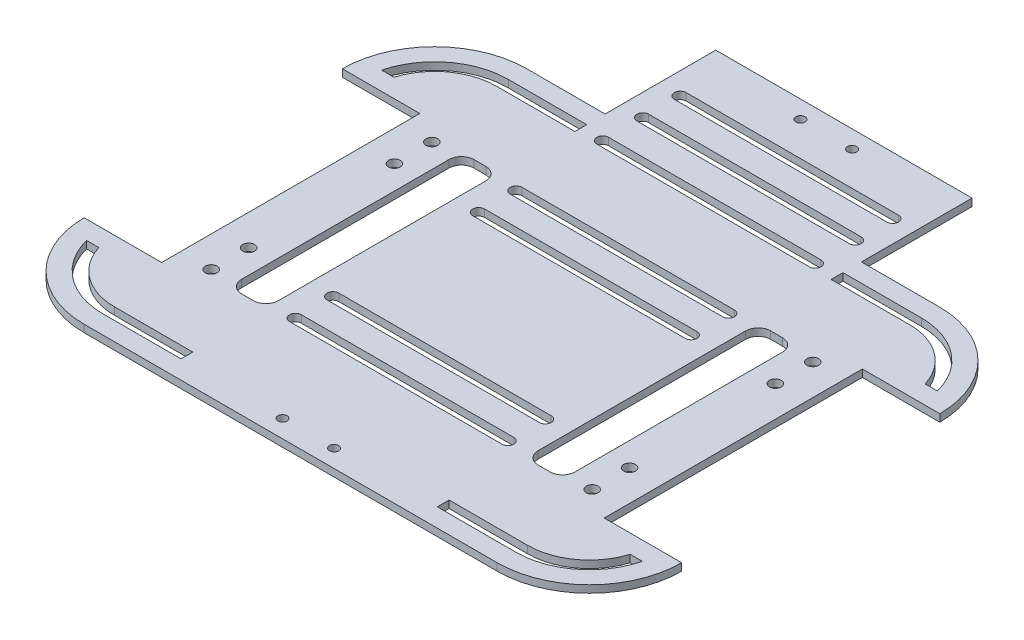
from build123d import *

# Parameters (mm, degrees)
SKETCH1_R            = 1.5875
BOSS_EXTRUDE5_DEPTH  = 1.5875
FILLET2_R            = 2.54
FILLET3_R            = 2.54
FILLET4_R            = 5.08
CUT_EXTRUDE1_START   = -2.54
SKETCH2_R            = 2.38125
SKETCH2_R_2          = 1.5875
CUT_EXTRUDE1_DEPTH   = 2.54
SKETCH3_R            = 1.5875
CUT_EXTRUDE2_DEPTH   = 2.54
CUT_EXTRUDE3_DEPTH   = 2.54
SKETCH5_W            = 15
SKETCH5_H            = 34.925
CUT_EXTRUDE4_DEPTH   = 109.650407999
FILLET5_R            = 7.62
FILLET6_R            = 7.62
SKETCH6_R            = 79.375
CUT_EXTRUDE5_DEPTH   = 0.5875
SKETCH8_W            = 24.650607139
SKETCH8_H            = 2
SKETCH8_W_2          = 29.436542116
CUT_EXTRUDE6_DEPTH   = 2.54
FILLET7_R            = 2.54
SKETCH11_W           = 22.261978792
SKETCH11_H           = 11.326269911
SKETCH11_H_2         = 10.545147849
BOSS_EXTRUDE7_DEPTH  = 1
SKETCH12_R           = 1.25
CUT_EXTRUDE7_DEPTH   = 2.54
SKETCH14_R           = 1.5875
BOSS_EXTRUDE8_DEPTH  = 1
SKETCH15_R           = 1.5875
CUT_EXTRUDE8_DEPTH   = 2.54
SKETCH16_W           = 0.79375
SKETCH16_H           = 25.283333333
SKETCH16_H_2         = 48.566666667
SKETCH16_H_3         = 73.85
BOSS_EXTRUDE13_DEPTH = 1
CUT_EXTRUDE10_DEPTH  = 109.643412285
BOSS_EXTRUDE16_START = -1
BOSS_EXTRUDE16_DEPTH = 1
SKETCH19_R           = 1.25
BOSS_EXTRUDE20_DEPTH = 2
SKETCH20_R           = 1.5875
CUT_EXTRUDE13_DEPTH  = 2
CUT_EXTRUDE18_DEPTH  = 2
SKETCH24_R           = 79.375
CUT_EXTRUDE20_DEPTH  = 297.956328007


with BuildPart() as part:
    # Sketch1 → Boss-Extrude5 (new body)
    with BuildSketch(Plane(origin=(0, 0, 0), x_dir=(1, 0, 0), z_dir=(0, 1, 0))):
        with BuildLine():
            ThreePointArc((-63.5, -47.625), (-35.497579143, -70.995158286), (0, -79.375))
            ThreePointArc((0, -79.375), (35.497579143, -70.995158286), (63.5, -47.625))
            Line((63.5, -47.625), (50.8, -47.625))
            Line((50.8, -47.625), (50.8, 22.225))
            Line((50.8, 22.225), (76.2, 22.225))
            ThreePointArc((76.2, 22.225), (0, 79.375), (-76.2, 22.225))
            Line((-76.2, 22.225), (-50.8, 22.225))
            Line((-50.8, 22.225), (-50.8, -47.625))
            Line((-50.8, -47.625), (-63.5, -47.625))
        make_face()
        with Locations(Location((-7.14375, -66.675, 0), (0, 0, 270))):
            Circle(SKETCH1_R, mode=Mode.SUBTRACT)
        with BuildLine():
            ThreePointArc((8.73125, -66.675), (7.14375, -68.2625), (5.55625, -66.675))
            ThreePointArc((5.55625, -66.675), (7.14375, -65.0875), (8.73125, -66.675))
        make_face(mode=Mode.SUBTRACT)
        with Locations(Location((-7.14375, 66.675, 0), (0, 0, 270))):
            Circle(SKETCH1_R, mode=Mode.SUBTRACT)
        with Locations(Location((7.14375, 66.675, 0), (0, 0, 270))):
            Circle(SKETCH1_R, mode=Mode.SUBTRACT)
    extrude(amount=BOSS_EXTRUDE5_DEPTH)

    # Fillet2
    fillet2_edges = [part.edges().sort_by_distance(p)[0] for p in [
        (-63.5, 0.79375, 47.625),
    ]]
    fillet(fillet2_edges, radius=FILLET2_R)

    # Fillet3
    fillet3_edges = [part.edges().sort_by_distance(p)[0] for p in [
        (63.5, 0.79375, 47.625),
    ]]
    fillet(fillet3_edges, radius=FILLET3_R)

    # Fillet4
    fillet4_edges = [part.edges().sort_by_distance(p)[0] for p in [
        (-76.2, 0.79375, -22.225),
        (76.2, 0.79375, -22.225),
    ]]
    fillet(fillet4_edges, radius=FILLET4_R)

    # Sketch2 → Cut-Extrude1 (cut)
    # profile 1 of 10: a face of its own
    with BuildSketch(Plane(origin=(0, 1.5875, 0), x_dir=(1, 0, 0), z_dir=(0, 1, 0)).offset(CUT_EXTRUDE1_START)):
        with BuildLine():
            Line((-61.088622125, 27.654457796), (-59.642408406, 26.999765402))
            ThreePointArc((-59.642408406, 26.999765402), (-52.384826382, 39.268743005), (-42.643785254, 49.676068599))
            Line((-42.643785254, 49.676068599), (-43.677815048, 50.880617741))
            Line((-43.677815048, 50.880617741), (-44.711844841, 52.085166883))
            ThreePointArc((-44.711844841, 52.085166883), (-54.925289002, 41.173126022), (-62.534835843, 28.309150189))
            Line((-62.534835843, 28.309150189), (-61.088622125, 27.654457796))
        make_face()
    # profile 2 of 10: a face of its own
    with BuildSketch(Plane(origin=(0, 1.5875, 0), x_dir=(1, 0, 0), z_dir=(0, 1, 0)).offset(CUT_EXTRUDE1_START)):
        with BuildLine():
            Line((-39.077069744, 54.493774041), (-38.151958122, 53.203686937))
            ThreePointArc((-38.151958122, 53.203686937), (-25.732218917, 60.200142208), (-12.092567045, 64.342629994))
            Line((-12.092567045, 64.342629994), (-12.385788543, 65.902815048))
            Line((-12.385788543, 65.902815048), (-12.679010041, 67.463000102))
            ThreePointArc((-12.679010041, 67.463000102), (-26.980132574, 63.119617589), (-40.002181367, 55.783861145))
            Line((-40.002181367, 55.783861145), (-39.077069744, 54.493774041))
        make_face()
    # profile 3 of 10: a face of its own
    with BuildSketch(Plane(origin=(0, 1.5875, 0), x_dir=(1, 0, 0), z_dir=(0, 1, 0)).offset(CUT_EXTRUDE1_START)):
        with Locations(Location((-7.14375, 66.675, 0), (0, 0, 270))):
            Circle(SKETCH2_R)
        with Locations((-7.14375, 66.675)):
            Circle(SKETCH2_R_2, mode=Mode.SUBTRACT)
    # profile 4 of 10: a face of its own
    with BuildSketch(Plane(origin=(0, 1.5875, 0), x_dir=(1, 0, 0), z_dir=(0, 1, 0)).offset(CUT_EXTRUDE1_START)):
        with Locations(Location((7.14375, 66.675, 0), (0, 0, 270))):
            Circle(SKETCH2_R)
        with Locations((7.14375, 66.675)):
            Circle(SKETCH2_R_2, mode=Mode.SUBTRACT)
    # profile 5 of 10: a face of its own
    with BuildSketch(Plane(origin=(0, 1.5875, 0), x_dir=(1, 0, 0), z_dir=(0, 1, 0)).offset(CUT_EXTRUDE1_START)):
        with BuildLine():
            ThreePointArc((12.679010041, 67.463000102), (26.980132574, 63.119617589), (40.002181367, 55.783861145))
            Line((40.002181367, 55.783861145), (39.077069744, 54.493774041))
            Line((39.077069744, 54.493774041), (38.151958122, 53.203686937))
            ThreePointArc((38.151958122, 53.203686937), (25.732218917, 60.200142208), (12.092567045, 64.342629994))
            Line((12.092567045, 64.342629994), (12.385788543, 65.902815048))
            Line((12.385788543, 65.902815048), (12.679010041, 67.463000102))
        make_face()
    # profile 6 of 10: a face of its own
    with BuildSketch(Plane(origin=(0, 1.5875, 0), x_dir=(1, 0, 0), z_dir=(0, 1, 0)).offset(CUT_EXTRUDE1_START)):
        with BuildLine():
            ThreePointArc((44.711844841, 52.085166883), (54.925289002, 41.173126022), (62.534835843, 28.309150189))
            Line((62.534835843, 28.309150189), (59.642408406, 26.999765402))
            ThreePointArc((59.642408406, 26.999765402), (52.384826382, 39.268743005), (42.643785254, 49.676068599))
            Line((42.643785254, 49.676068599), (43.677815048, 50.880617741))
            Line((43.677815048, 50.880617741), (44.711844841, 52.085166883))
        make_face()
    # profile 7 of 10: a face of its own
    with BuildSketch(Plane(origin=(0, 1.5875, 0), x_dir=(1, 0, 0), z_dir=(0, 1, 0)).offset(CUT_EXTRUDE1_START)):
        with BuildLine():
            ThreePointArc((-12.679010041, -67.463000102), (-26.980132574, -63.119617589), (-40.002181367, -55.783861145))
            Line((-40.002181367, -55.783861145), (-39.077069744, -54.493774041))
            Line((-39.077069744, -54.493774041), (-38.151958122, -53.203686937))
            ThreePointArc((-38.151958122, -53.203686937), (-25.732218917, -60.200142208), (-12.092567045, -64.342629994))
            Line((-12.092567045, -64.342629994), (-12.385788543, -65.902815048))
            Line((-12.385788543, -65.902815048), (-12.679010041, -67.463000102))
        make_face()
    # profile 8 of 10: a face of its own
    with BuildSketch(Plane(origin=(0, 1.5875, 0), x_dir=(1, 0, 0), z_dir=(0, 1, 0)).offset(CUT_EXTRUDE1_START)):
        with Locations(Location((-7.14375, -66.675, 0), (0, 0, 270))):
            Circle(SKETCH2_R)
        with Locations((-7.14375, -66.675)):
            Circle(SKETCH2_R_2, mode=Mode.SUBTRACT)
    # profile 9 of 10: a face of its own
    with BuildSketch(Plane(origin=(0, 1.5875, 0), x_dir=(1, 0, 0), z_dir=(0, 1, 0)).offset(CUT_EXTRUDE1_START)):
        with Locations(Location((7.14375, -66.675, 0), (0, 0, 270))):
            Circle(SKETCH2_R)
        with Locations((7.14375, -66.675)):
            Circle(SKETCH2_R_2, mode=Mode.SUBTRACT)
    # profile 10 of 10: a face of its own
    with BuildSketch(Plane(origin=(0, 1.5875, 0), x_dir=(1, 0, 0), z_dir=(0, 1, 0)).offset(CUT_EXTRUDE1_START)):
        with BuildLine():
            ThreePointArc((12.092567045, -64.342629994), (25.732218917, -60.200142208), (38.151958122, -53.203686937))
            Line((38.151958122, -53.203686937), (39.077069744, -54.493774041))
            Line((39.077069744, -54.493774041), (40.002181367, -55.783861145))
            ThreePointArc((40.002181367, -55.783861145), (26.980132574, -63.119617589), (12.679010041, -67.463000102))
            Line((12.679010041, -67.463000102), (12.385788543, -65.902815048))
            Line((12.385788543, -65.902815048), (12.092567045, -64.342629994))
        make_face()
    extrude(amount=CUT_EXTRUDE1_DEPTH, mode=Mode.SUBTRACT)

    # Sketch3 → Cut-Extrude2 (cut)
    with BuildSketch(Plane(origin=(0, 1.5875, 0), x_dir=(1, 0, 0), z_dir=(0, 1, 0))):
        with Locations(Location((-44.45, -47.625, 0), (0, 0, 270))):
            Circle(SKETCH3_R)
        with Locations(Location((-44.45, 22.225, 0), (0, 0, 270))):
            Circle(SKETCH3_R)
        with Locations(Location((44.45, 22.225, 0), (0, 0, 270))):
            Circle(SKETCH3_R)
        with Locations(Location((44.45, -47.625, 0), (0, 0, 270))):
            Circle(SKETCH3_R)
    extrude(amount=-CUT_EXTRUDE2_DEPTH, mode=Mode.SUBTRACT)

    # Sketch4 → Cut-Extrude3 (cut)
    with BuildSketch(Plane(origin=(0, 1.5875, 0), x_dir=(1, 0, 0), z_dir=(0, 1, 0))):
        with BuildLine():
            ThreePointArc((-44.45, -11.1125), (-46.0375, -12.7), (-44.45, -14.2875))
            Line((-44.45, -14.2875), (-44.45, -11.1125))
        make_face()
        with BuildLine():
            Line((-44.45, -11.1125), (-44.45, -14.2875))
            ThreePointArc((-44.45, -14.2875), (-43.327467985, -13.822532015), (-42.8625, -12.7))
            ThreePointArc((-42.8625, -12.7), (-43.327467985, -11.577467985), (-44.45, -11.1125))
        make_face()
        with BuildLine():
            ThreePointArc((44.45, -11.1125), (42.8625, -12.7), (44.45, -14.2875))
            Line((44.45, -14.2875), (44.45, -11.1125))
        make_face()
        with BuildLine():
            Line((44.45, -11.1125), (44.45, -14.2875))
            ThreePointArc((44.45, -14.2875), (45.572532015, -13.822532015), (46.0375, -12.7))
            ThreePointArc((46.0375, -12.7), (45.572532015, -11.577467985), (44.45, -11.1125))
        make_face()
    extrude(amount=-CUT_EXTRUDE3_DEPTH, mode=Mode.SUBTRACT)

    # Sketch5 → Cut-Extrude4 (cut, through all)
    with BuildSketch(Plane(origin=(0, 1.5875, 0), x_dir=(1, 0, 0), z_dir=(0, 1, 0))):
        with Locations((-27.3, 4.7625)):
            Rectangle(SKETCH5_W, SKETCH5_H)
        with Locations((27.3, 4.7625)):
            Rectangle(SKETCH5_W, SKETCH5_H)
    extrude(amount=-CUT_EXTRUDE4_DEPTH, mode=Mode.SUBTRACT)

    # Fillet5
    # the kernel refuses this fillet: 7.62 mm, written as the material it adds along each edge
    with BuildSketch(Plane(origin=(-19.8, 1.5875, 12.7), x_dir=(0, 0, -1), z_dir=(0, -1, 0))) as fillet5_piece_1:
        with BuildLine():
            CenterArc((FILLET5_R, -FILLET5_R), FILLET5_R, 90, 90)
            Line((0, -FILLET5_R), (0, 0))
            Line((0, 0), (FILLET5_R, 0))
        make_face()
    extrude(amount=1.5875)
    with BuildSketch(Plane(origin=(-34.8, 1.5875, 12.7), x_dir=(0, 0, -1), z_dir=(0, -1, 0)), Plane(origin=(-19.8, 1.5875, -22.225), x_dir=(0, 0, 1), z_dir=(0, -1, 0)), Plane(origin=(-34.8, 1.5875, -22.225), x_dir=(1, 0, 0), z_dir=(0, -1, 0))) as fillet5_piece_2:
        with BuildLine():
            CenterArc((FILLET5_R, FILLET5_R), FILLET5_R, 180, 90)
            Line((0, FILLET5_R), (0, 0))
            Line((0, 0), (FILLET5_R, 0))
        make_face()
    extrude(amount=1.5875)

    # Fillet6
    # the kernel refuses this fillet: 7.62 mm, written as the material it adds along each edge
    with BuildSketch(Plane(origin=(34.8, 1.5875, 12.7), x_dir=(0, 0, -1), z_dir=(0, -1, 0)), Plane(origin=(34.8, 1.5875, -22.225), x_dir=(-1, 0, 0), z_dir=(0, -1, 0))) as fillet6_piece_1:
        with BuildLine():
            CenterArc((FILLET6_R, -FILLET6_R), FILLET6_R, 90, 90)
            Line((0, -FILLET6_R), (0, 0))
            Line((0, 0), (FILLET6_R, 0))
        make_face()
    extrude(amount=1.5875)
    with BuildSketch(Plane(origin=(19.8, 1.5875, -22.225), x_dir=(1, 0, 0), z_dir=(0, -1, 0)), Plane(origin=(19.8, 1.5875, 12.7), x_dir=(0, 0, -1), z_dir=(0, -1, 0))) as fillet6_piece_2:
        with BuildLine():
            CenterArc((FILLET6_R, FILLET6_R), FILLET6_R, 180, 90)
            Line((0, FILLET6_R), (0, 0))
            Line((0, 0), (FILLET6_R, 0))
        make_face()
    extrude(amount=1.5875)

    # Sketch6 → Cut-Extrude5 (cut)
    with BuildSketch(Plane(origin=(0, 0, 0), x_dir=(-1, 0, 0), z_dir=(0, -1, 0))):
        Circle(SKETCH6_R)
    extrude(amount=-CUT_EXTRUDE5_DEPTH, mode=Mode.SUBTRACT)

    # Sketch8 → Cut-Extrude6 (cut)
    with BuildSketch(Plane(origin=(0, 1.5875, 0), x_dir=(1, 0, 0), z_dir=(0, 1, 0))):
        with Locations((-63.12530357, -48.625)):
            Rectangle(SKETCH8_W, SKETCH8_H)
        with Locations((63.12530357, -48.625)):
            Rectangle(SKETCH8_W, SKETCH8_H)
        with Locations((65.518271058, 23.225)):
            Rectangle(SKETCH8_W_2, SKETCH8_H)
        with Locations((-65.518271058, 23.225)):
            Rectangle(SKETCH8_W_2, SKETCH8_H)
    extrude(amount=-CUT_EXTRUDE6_DEPTH, mode=Mode.SUBTRACT)

    # Fillet7
    fillet7_edges = [part.edges().sort_by_distance(p)[0] for p in [
        (-73.13527216, 1.0875, -24.225),
    ]]
    fillet(fillet7_edges, radius=FILLET7_R)
    fillet7_2_edges = [part.edges().sort_by_distance(p)[0] for p in [
        (-60.680646055, 1.0875, 49.625),
    ]]
    fillet(fillet7_2_edges, radius=FILLET7_R)
    fillet7_3_edges = [part.edges().sort_by_distance(p)[0] for p in [
        (73.13527216, 1.0875, -24.225),
    ]]
    fillet(fillet7_3_edges, radius=FILLET7_R)
    fillet7_4_edges = [part.edges().sort_by_distance(p)[0] for p in [
        (60.680646055, 1.0875, 49.625),
    ]]
    fillet(fillet7_4_edges, radius=FILLET7_R)

    # Sketch11 → Boss-Extrude7 (add)
    with BuildSketch(Plane(origin=(0, 1.5875, 0), x_dir=(1, 0, 0), z_dir=(0, 1, 0))):
        with Locations((0.072710042, 66.44599468)):
            Rectangle(SKETCH11_W, SKETCH11_H)
        with Locations((0.072710042, -66.930597559)):
            Rectangle(SKETCH11_W, SKETCH11_H_2)
    extrude(amount=-BOSS_EXTRUDE7_DEPTH)

    # Sketch12 → Cut-Extrude7 (cut)
    with BuildSketch(Plane(origin=(0, 1.5875, 0), x_dir=(1, 0, 0), z_dir=(0, 1, 0))):
        with Locations(Location((-6.75, 65.902815048, 0), (0, 0, 270))):
            Circle(SKETCH12_R)
        with Locations(Location((6.75, 65.902815048, 0), (0, 0, 270))):
            Circle(SKETCH12_R)
        with Locations(Location((6.75, -65.902815048, 0), (0, 0, 270))):
            Circle(SKETCH12_R)
        with Locations(Location((-6.75, -65.902815048, 0), (0, 0, 270))):
            Circle(SKETCH12_R)
    extrude(amount=-CUT_EXTRUDE7_DEPTH, mode=Mode.SUBTRACT)

    # Sketch14 → Boss-Extrude8 (add)
    with BuildSketch(Plane(origin=(0, 1.5875, 0), x_dir=(1, 0, 0), z_dir=(0, 1, 0))):
        with Locations((-44.45, -12.7)):
            Circle(SKETCH14_R)
        with Locations((44.45, -12.7)):
            Circle(SKETCH14_R)
    extrude(amount=-BOSS_EXTRUDE8_DEPTH)

    # Sketch15 → Cut-Extrude8 (cut)
    with BuildSketch(Plane(origin=(0, 1.5875, 0), x_dir=(1, 0, 0), z_dir=(0, 1, 0))):
        with Locations(Location((-44.45, -1.058333333, 0), (0, 0, 270))):
            Circle(SKETCH15_R)
        with Locations(Location((-44.45, -24.341666667, 0), (0, 0, 270))):
            Circle(SKETCH15_R)
        with Locations(Location((44.45, -24.341666667, 0), (0, 0, 270))):
            Circle(SKETCH15_R)
        with Locations(Location((44.45, -1.058333333, 0), (0, 0, 270))):
            Circle(SKETCH15_R)
    extrude(amount=-CUT_EXTRUDE8_DEPTH, mode=Mode.SUBTRACT)

    # Sketch16 → Boss-Extrude13 (add)
    with BuildSketch(Plane(origin=(0, 1.5875, 0), x_dir=(1, 0, 0), z_dir=(0, 1, 0))):
        with Locations((-51.196875, 11.583333334)):
            Rectangle(SKETCH16_W, SKETCH16_H)
        with Locations((-51.196875, -25.341666667)):
            Rectangle(SKETCH16_W, SKETCH16_H_2)
        with Locations((51.196875, -12.7)):
            Rectangle(SKETCH16_W, SKETCH16_H_3)
    extrude(amount=-BOSS_EXTRUDE13_DEPTH)

    # Sketch17 → Cut-Extrude10 (cut, through all)
    with BuildSketch(Plane(origin=(0, 1.5875, 0), x_dir=(1, 0, 0), z_dir=(0, 1, 0))):
        with BuildLine():
            ThreePointArc((-59.642408406, 26.999765402), (-40.146347222, 51.715326712), (-11.368591443, 64.474485968))
            Line((-11.368591443, 64.474485968), (-11.919924408, 67.601250584))
            ThreePointArc((-11.919924408, 67.601250584), (-42.093290669, 54.223321173), (-62.534835843, 28.309150189))
            Line((-62.534835843, 28.309150189), (-59.642408406, 26.999765402))
        make_face()
        with BuildLine():
            Line((11.919924408, 67.601250584), (11.368591443, 64.474485968))
            ThreePointArc((11.368591443, 64.474485968), (40.146347222, 51.715326712), (59.642408406, 26.999765402))
            Line((59.642408406, 26.999765402), (62.534835843, 28.309150189))
            ThreePointArc((62.534835843, 28.309150189), (42.093290669, 54.223321173), (11.919924408, 67.601250584))
        make_face()
        with BuildLine():
            ThreePointArc((38.151958122, -53.203686937), (25.393482136, -60.343808939), (11.368591443, -64.474485968))
            Line((11.368591443, -64.474485968), (11.919924408, -67.601250584))
            ThreePointArc((11.919924408, -67.601250584), (26.624968362, -63.270251604), (40.002181367, -55.783861145))
            Line((40.002181367, -55.783861145), (38.151958122, -53.203686937))
        make_face()
        with BuildLine():
            ThreePointArc((-11.368591443, -64.474485968), (-25.393482136, -60.343808939), (-38.151958122, -53.203686937))
            Line((-38.151958122, -53.203686937), (-40.002181367, -55.783861145))
            ThreePointArc((-40.002181367, -55.783861145), (-26.624968362, -63.270251604), (-11.919924408, -67.601250584))
            Line((-11.919924408, -67.601250584), (-11.368591443, -64.474485968))
        make_face()
    extrude(amount=-CUT_EXTRUDE10_DEPTH, mode=Mode.SUBTRACT)

    # Sketch18 → Boss-Extrude16 (add)
    with BuildSketch(Plane(origin=(0, 1.5875, 0), x_dir=(1, 0, 0), z_dir=(0, 1, 0)).offset(BOSS_EXTRUDE16_START)):
        with BuildLine():
            Line((-34.32205442, -59.447542075), (-32.73455442, -56.697911418))
            ThreePointArc((-32.73455442, -56.697911418), (-35.486290539, -55.017518992), (-38.151958122, -53.203686937))
            Line((-38.151958122, -53.203686937), (-40.002181367, -55.783861145))
            ThreePointArc((-40.002181367, -55.783861145), (-37.207239159, -57.685657078), (-34.32205442, -59.447542075))
        make_face()
        with BuildLine():
            ThreePointArc((38.151958122, -53.203686937), (35.486290539, -55.017518992), (32.73455442, -56.697911418))
            Line((32.73455442, -56.697911418), (34.32205442, -59.447542075))
            ThreePointArc((34.32205442, -59.447542075), (37.207239159, -57.685657078), (40.002181367, -55.783861145))
            Line((40.002181367, -55.783861145), (38.151958122, -53.203686937))
        make_face()
        with BuildLine():
            Line((59.447542075, 34.32205442), (56.697911418, 32.73455442))
            ThreePointArc((56.697911418, 32.73455442), (58.240788589, 29.90342383), (59.642408406, 26.999765402))
            Line((59.642408406, 26.999765402), (62.534835843, 28.309150189))
            ThreePointArc((62.534835843, 28.309150189), (61.065242855, 31.353624885), (59.447542075, 34.32205442))
        make_face()
        with BuildLine():
            Line((34.32205442, 59.447542075), (32.73455442, 56.697911418))
            ThreePointArc((32.73455442, 56.697911418), (37.551538139, 53.629154344), (42.082731979, 50.152247023))
            Line((42.082731979, 50.152247023), (44.12358264, 52.584438129))
            ThreePointArc((44.12358264, 52.584438129), (39.372643325, 56.229962084), (34.32205442, 59.447542075))
        make_face()
        with BuildLine():
            ThreePointArc((-42.082731979, 50.152247023), (-37.551538139, 53.629154344), (-32.73455442, 56.697911418))
            Line((-32.73455442, 56.697911418), (-34.32205442, 59.447542075))
            ThreePointArc((-34.32205442, 59.447542075), (-39.372643325, 56.229962084), (-44.12358264, 52.584438129))
            Line((-44.12358264, 52.584438129), (-42.082731979, 50.152247023))
        make_face()
        with BuildLine():
            ThreePointArc((-59.642408406, 26.999765402), (-58.240788589, 29.90342383), (-56.697911418, 32.73455442))
            Line((-56.697911418, 32.73455442), (-59.447542075, 34.32205442))
            ThreePointArc((-59.447542075, 34.32205442), (-61.065242855, 31.353624885), (-62.534835843, 28.309150189))
            Line((-62.534835843, 28.309150189), (-59.642408406, 26.999765402))
        make_face()
    extrude(amount=BOSS_EXTRUDE16_DEPTH)

    # Sketch24 → Cut-Extrude20 (cut, through all)
    with BuildSketch(Plane(origin=(0, 3.5875, 0), x_dir=(1, 0, 0), z_dir=(0, 1, 0))):
        Circle(SKETCH24_R)
    extrude(amount=-CUT_EXTRUDE20_DEPTH, mode=Mode.SUBTRACT)


with BuildPart() as body_2:
    # Sketch19 → Boss-Extrude20 (new body)
    with BuildSketch(Plane(origin=(0, 1.5875, 0), x_dir=(1, 0, 0), z_dir=(0, 1, 0))):
        with BuildLine():
            Line((33.700005206, 185.112408933), (33.700005206, 150.112408933))
            Line((33.700005206, 150.112408933), (33.700005206, 115.112408933))
            Line((33.700005206, 115.112408933), (12.700005206, 115.112408933))
            ThreePointArc((12.700005206, 115.112408933), (20.022335677, 97.434739403), (37.700005206, 90.112408933))
            Line((37.700005206, 90.112408933), (93.700005206, 90.112408933))
            Line((93.700005206, 90.112408933), (149.700005206, 90.112408933))
            ThreePointArc((149.700005206, 90.112408933), (167.377674736, 97.434739403), (174.700005206, 115.112408933))
            Line((174.700005206, 115.112408933), (153.700005206, 115.112408933))
            Line((153.700005206, 115.112408933), (153.700005206, 150.112408933))
            Line((153.700005206, 150.112408933), (153.700005206, 185.112408933))
            Line((153.700005206, 185.112408933), (174.700005206, 185.112408933))
            ThreePointArc((174.700005206, 185.112408933), (167.377674736, 202.790078463), (149.700005206, 210.112408933))
            Line((149.700005206, 210.112408933), (128.446980003, 210.112408933))
            Line((128.446980003, 210.112408933), (128.446980003, 240.112408933))
            Line((128.446980003, 240.112408933), (58.95303041, 240.112408933))
            Line((58.95303041, 240.112408933), (58.95303041, 210.112408933))
            Line((58.95303041, 210.112408933), (37.700005206, 210.112408933))
            ThreePointArc((37.700005206, 210.112408933), (20.022335677, 202.790078463), (12.700005206, 185.112408933))
            Line((12.700005206, 185.112408933), (33.700005206, 185.112408933))
        make_face()
        with Locations(Location((86.693968484, 94.895303866, 0), (0, 0, 270))):
            Circle(SKETCH19_R, mode=Mode.SUBTRACT)
        with Locations(Location((100.706041929, 235.329514, 0), (0, 0, 270))):
            Circle(SKETCH19_R, mode=Mode.SUBTRACT)
        with Locations(Location((100.706041929, 94.895303866, 0), (0, 0, 270))):
            Circle(SKETCH19_R, mode=Mode.SUBTRACT)
        with Locations(Location((86.693968484, 235.329514, 0), (0, 0, 270))):
            Circle(SKETCH19_R, mode=Mode.SUBTRACT)
    extrude(amount=BOSS_EXTRUDE20_DEPTH)

    # Sketch20 → Cut-Extrude13 (cut)
    with BuildSketch(Plane(origin=(0, 3.5875, 0), x_dir=(1, 0, 0), z_dir=(0, 1, 0))):
        with Locations(Location((42.050005206, 180.032408933, 0), (0, 0, 270))):
            Circle(SKETCH20_R)
        with Locations(Location((42.050005206, 169.872408933, 0), (0, 0, 270))):
            Circle(SKETCH20_R)
        with Locations(Location((42.050005206, 130.352408933, 0), (0, 0, 270))):
            Circle(SKETCH20_R)
        with Locations(Location((42.050005206, 120.192408933, 0), (0, 0, 270))):
            Circle(SKETCH20_R)
        with Locations(Location((145.350005206, 120.192408933, 0), (0, 0, 270))):
            Circle(SKETCH20_R)
        with Locations(Location((145.350005206, 130.352408933, 0), (0, 0, 270))):
            Circle(SKETCH20_R)
        with Locations(Location((145.350005206, 169.872408933, 0), (0, 0, 270))):
            Circle(SKETCH20_R)
        with Locations(Location((145.350005206, 180.032408933, 0), (0, 0, 270))):
            Circle(SKETCH20_R)
    extrude(amount=-CUT_EXTRUDE13_DEPTH, mode=Mode.SUBTRACT)

    # Sketch23 → Cut-Extrude18 (cut)
    with BuildSketch(Plane(origin=(0, 3.5875, 0), x_dir=(1, 0, 0), z_dir=(0, 1, 0))):
        with BuildLine():
            Line((122.496980003, 181.632408933), (64.90303041, 181.632408933))
            ThreePointArc((64.90303041, 181.632408933), (63.30303041, 180.032408933), (64.90303041, 178.432408933))
            Line((64.90303041, 178.432408933), (122.496980003, 178.432408933))
            ThreePointArc((122.496980003, 178.432408933), (124.096980003, 180.032408933), (122.496980003, 181.632408933))
        make_face()
        with BuildLine():
            Line((55.076517808, 181.632408933), (51.876517808, 181.632408933))
            ThreePointArc((51.876517808, 181.632408933), (49.472354752, 180.636571989), (48.476517808, 178.232408933))
            Line((48.476517808, 178.232408933), (48.476517808, 121.992408933))
            ThreePointArc((48.476517808, 121.992408933), (49.472354752, 119.588245877), (51.876517808, 118.592408933))
            Line((51.876517808, 118.592408933), (55.076517808, 118.592408933))
            ThreePointArc((55.076517808, 118.592408933), (57.480680864, 119.588245877), (58.476517808, 121.992408933))
            Line((58.476517808, 121.992408933), (58.476517808, 178.232408933))
            ThreePointArc((58.476517808, 178.232408933), (57.480680864, 180.636571989), (55.076517808, 181.632408933))
        make_face()
        with BuildLine():
            ThreePointArc((37.700005206, 205.112408933), (25.452556492, 200.923797234), (18.335088475, 190.112408933))
            Line((18.335088475, 190.112408933), (21.661302017, 190.112408933))
            ThreePointArc((21.661302017, 190.112408933), (27.744102435, 198.644592792), (37.700005206, 201.912408933))
            Line((37.700005206, 201.912408933), (58.95303041, 201.912408933))
            Line((58.95303041, 201.912408933), (58.95303041, 205.112408933))
            Line((58.95303041, 205.112408933), (37.700005206, 205.112408933))
        make_face()
        with BuildLine():
            ThreePointArc((122.496980003, 222.932408933), (124.096980003, 224.532408933), (122.496980003, 226.132408933))
            Line((122.496980003, 226.132408933), (64.90303041, 226.132408933))
            ThreePointArc((64.90303041, 226.132408933), (63.30303041, 224.532408933), (64.90303041, 222.932408933))
            Line((64.90303041, 222.932408933), (122.496980003, 222.932408933))
        make_face()
        with BuildLine():
            ThreePointArc((122.496980003, 168.272408933), (124.096980003, 169.872408933), (122.496980003, 171.472408933))
            Line((122.496980003, 171.472408933), (64.90303041, 171.472408933))
            ThreePointArc((64.90303041, 171.472408933), (63.30303041, 169.872408933), (64.90303041, 168.272408933))
            Line((64.90303041, 168.272408933), (122.496980003, 168.272408933))
        make_face()
        with BuildLine():
            Line((165.738708396, 190.112408933), (169.064921937, 190.112408933))
            ThreePointArc((169.064921937, 190.112408933), (161.94745392, 200.923797234), (149.700005206, 205.112408933))
            Line((149.700005206, 205.112408933), (128.446980003, 205.112408933))
            Line((128.446980003, 205.112408933), (128.446980003, 201.912408933))
            Line((128.446980003, 201.912408933), (149.700005206, 201.912408933))
            ThreePointArc((149.700005206, 201.912408933), (159.655907978, 198.644592792), (165.738708396, 190.112408933))
        make_face()
        with BuildLine():
            ThreePointArc((122.496980003, 212.772408933), (124.096980003, 214.372408933), (122.496980003, 215.972408933))
            Line((122.496980003, 215.972408933), (64.90303041, 215.972408933))
            ThreePointArc((64.90303041, 215.972408933), (63.30303041, 214.372408933), (64.90303041, 212.772408933))
            Line((64.90303041, 212.772408933), (122.496980003, 212.772408933))
        make_face()
        with BuildLine():
            Line((122.496980003, 131.952408933), (64.90303041, 131.952408933))
            ThreePointArc((64.90303041, 131.952408933), (63.30303041, 130.352408933), (64.90303041, 128.752408933))
            Line((64.90303041, 128.752408933), (122.496980003, 128.752408933))
            ThreePointArc((122.496980003, 128.752408933), (124.096980003, 130.352408933), (122.496980003, 131.952408933))
        make_face()
        with BuildLine():
            ThreePointArc((122.496980003, 118.592408933), (124.096980003, 120.192408933), (122.496980003, 121.792408933))
            Line((122.496980003, 121.792408933), (64.90303041, 121.792408933))
            ThreePointArc((64.90303041, 121.792408933), (63.30303041, 120.192408933), (64.90303041, 118.592408933))
            Line((64.90303041, 118.592408933), (122.496980003, 118.592408933))
        make_face()
        with BuildLine():
            Line((122.496980003, 205.112408933), (64.90303041, 205.112408933))
            ThreePointArc((64.90303041, 205.112408933), (63.30303041, 203.512408933), (64.90303041, 201.912408933))
            Line((64.90303041, 201.912408933), (122.496980003, 201.912408933))
            ThreePointArc((122.496980003, 201.912408933), (124.096980003, 203.512408933), (122.496980003, 205.112408933))
        make_face()
        with BuildLine():
            Line((21.661302017, 110.112408933), (18.335088475, 110.112408933))
            ThreePointArc((18.335088475, 110.112408933), (25.452556492, 99.301020632), (37.700005206, 95.112408933))
            Line((37.700005206, 95.112408933), (58.95303041, 95.112408933))
            Line((58.95303041, 95.112408933), (58.95303041, 98.312408933))
            Line((58.95303041, 98.312408933), (37.700005206, 98.312408933))
            ThreePointArc((37.700005206, 98.312408933), (27.744102435, 101.580225074), (21.661302017, 110.112408933))
        make_face()
        with BuildLine():
            Line((128.446980003, 95.112408933), (149.700005206, 95.112408933))
            ThreePointArc((149.700005206, 95.112408933), (161.94745392, 99.301020632), (169.064921937, 110.112408933))
            Line((169.064921937, 110.112408933), (165.738708396, 110.112408933))
            ThreePointArc((165.738708396, 110.112408933), (159.655907978, 101.580225074), (149.700005206, 98.312408933))
            Line((149.700005206, 98.312408933), (128.446980003, 98.312408933))
            Line((128.446980003, 98.312408933), (128.446980003, 95.112408933))
        make_face()
        with BuildLine():
            ThreePointArc((135.523492605, 118.592408933), (137.927655661, 119.588245877), (138.923492605, 121.992408933))
            Line((138.923492605, 121.992408933), (138.923492605, 178.232408933))
            ThreePointArc((138.923492605, 178.232408933), (137.927655661, 180.636571989), (135.523492605, 181.632408933))
            Line((135.523492605, 181.632408933), (132.323492605, 181.632408933))
            ThreePointArc((132.323492605, 181.632408933), (129.919329549, 180.636571989), (128.923492605, 178.232408933))
            Line((128.923492605, 178.232408933), (128.923492605, 121.992408933))
            ThreePointArc((128.923492605, 121.992408933), (129.919329549, 119.588245877), (132.323492605, 118.592408933))
            Line((132.323492605, 118.592408933), (135.523492605, 118.592408933))
        make_face()
    extrude(amount=-CUT_EXTRUDE18_DEPTH, mode=Mode.SUBTRACT)


solid = body_2.part
